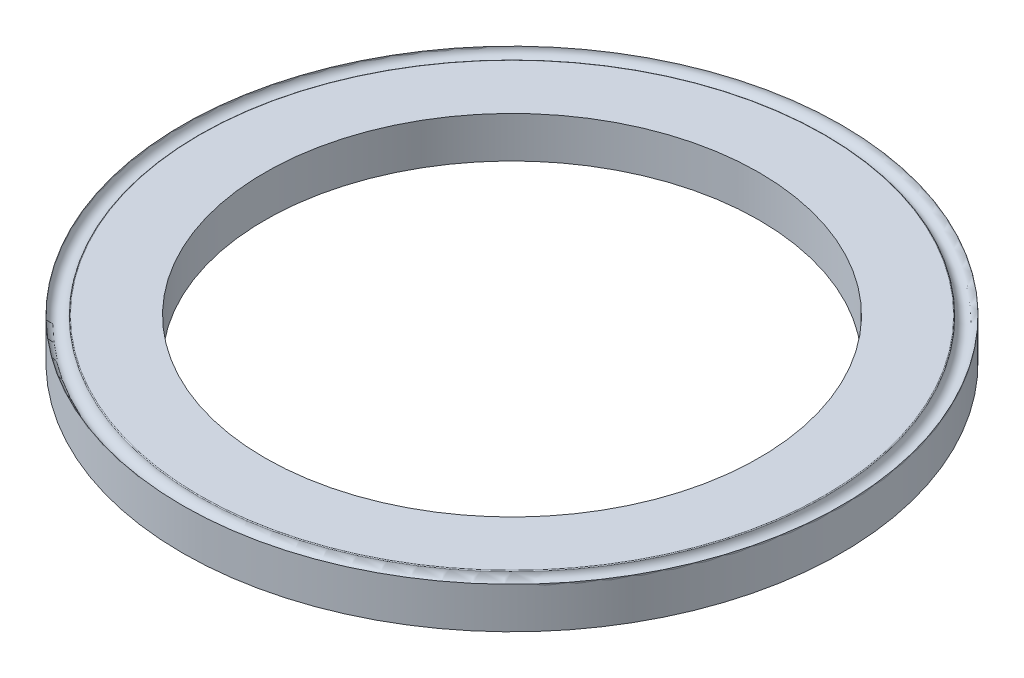
from build123d import *

# Parameters (mm, degrees)
DIAPROFILES_R    = 4
DIAPROFILES_R_2  = 3
DIAPROFILE_DEPTH = 0.25


with BuildPart() as part:
    # DiaProfileS → DiaProfile (new, symmetric)
    with BuildSketch(Plane(origin=(0, 0, 0), x_dir=(1, 0, 0), z_dir=(0, 1, 0))):
        Circle(DIAPROFILES_R)
        Circle(DIAPROFILES_R_2, mode=Mode.SUBTRACT)
    extrude(amount=DIAPROFILE_DEPTH, both=True)

    # CrimpS → Crimp (revolve, cut)
    with BuildSketch(Plane.XY):
        with BuildLine():
            Line((-4, 0.25), (-3.790455488, 0.25))
            ThreePointArc((-3.790455488, 0.25), (-3.797197487, 0.247385489), (-3.80041408, 0.240909091))
            ThreePointArc((-3.80041408, 0.240909091), (-3.904550167, 0.150103574), (-4, 0.25))
        make_face()
    revolve(axis=Axis((0, 0.25, 0), (0, -1, 0)), mode=Mode.SUBTRACT)


solid = part.part
